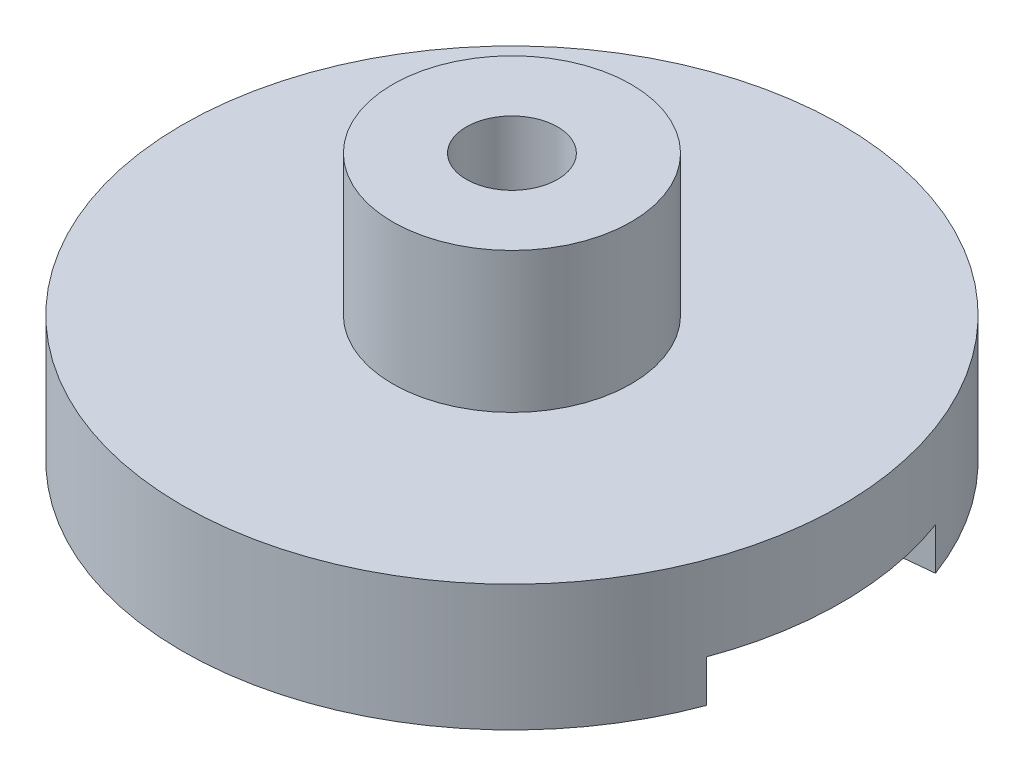
from build123d import *

# Parameters (mm, degrees)
SKETCH_1_R          = 23.5
EXTRUDE_1_DEPTH     = 3
CUT_EXTRUDE_1_DEPTH = 3
SKETCH_2_R          = 23.5
EXTRUDE_2_DEPTH     = 6
SKETCH_3_R          = 8.5
EXTRUDE_3_DEPTH     = 10
SKETCH_4_R          = 3.25
CUT_EXTRUDE_2_DEPTH = 19
CUT_EXTRUDE_3_DEPTH = 4.5


with BuildPart() as part:
    # Эскиз1 → Бобышка-Вытянуть1 (new body)
    with BuildSketch(Plane(origin=(0, 0, 0), x_dir=(1, 0, 0), z_dir=(0, 1, 0))):
        Circle(SKETCH_1_R)
    extrude(amount=EXTRUDE_1_DEPTH)

    # Эскиз1<4> → Вырез-Вытянуть1 (cut)
    with BuildSketch(Plane(origin=(0, 0, 0), x_dir=(1, 0, 0), z_dir=(0, 1, 0))):
        with BuildLine():
            Line((22.039659064, 8.154963419), (-15.718908182, 4.379106694))
            ThreePointArc((-15.718908182, 4.379106694), (-17.131195574, 3.666236581), (-17.7, 2.190024876))
            Line((-17.7, 2.190024876), (-17.7, -2.190024876))
            ThreePointArc((-17.7, -2.190024876), (-17.131195574, -3.666236581), (-15.718908182, -4.379106694))
            Line((-15.718908182, -4.379106694), (22.039659064, -8.154963419))
            ThreePointArc((22.039659064, -8.154963419), (23.5, 0), (22.039659064, 8.154963419))
        make_face()
    extrude(amount=CUT_EXTRUDE_1_DEPTH, mode=Mode.SUBTRACT)

    # Эскиз2 → Бобышка-Вытянуть2 (add)
    with BuildSketch(Plane(origin=(0, 3, 0), x_dir=(1, 0, 0), z_dir=(0, 1, 0))):
        Circle(SKETCH_2_R)
    extrude(amount=EXTRUDE_2_DEPTH)

    # Эскиз3 → Бобышка-Вытянуть3 (add)
    with BuildSketch(Plane(origin=(0, 9, 0), x_dir=(1, 0, 0), z_dir=(0, 1, 0))):
        Circle(SKETCH_3_R)
    extrude(amount=EXTRUDE_3_DEPTH)

    # Эскиз4 → Вырез-Вытянуть2 (cut)
    with BuildSketch(Plane(origin=(0, 19, 0), x_dir=(1, 0, 0), z_dir=(0, 1, 0))):
        Circle(SKETCH_4_R)
    extrude(amount=-CUT_EXTRUDE_2_DEPTH, mode=Mode.SUBTRACT)

    # Эскиз5 → Вырез-Вытянуть3 (cut)
    with BuildSketch(Plane.XZ.offset(-3)):
        Polygon((5.773502692, 0), (2.886751346, 5), (-2.886751346, 5), (-5.773502692, 0), (-2.886751346, -5), (2.886751346, -5), align=None)
    extrude(amount=-CUT_EXTRUDE_3_DEPTH, mode=Mode.SUBTRACT)


solid = part.part
